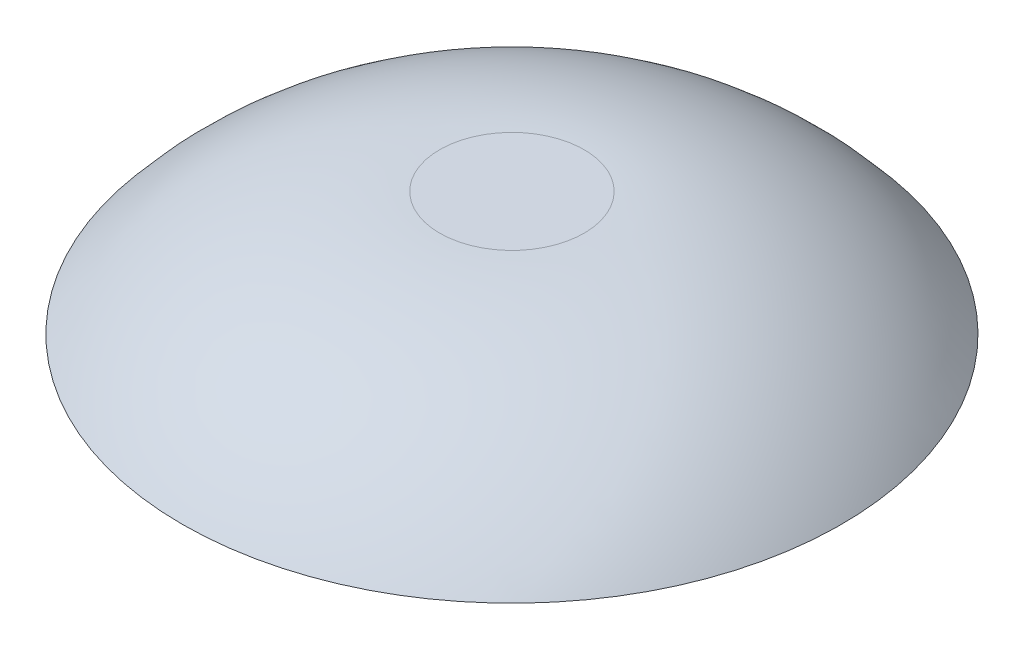
from build123d import *

# Parameters (mm, degrees)
SKETCH1_R           = 20
BOSS_EXTRUDE1_DEPTH = 7.5
FILLET1_R           = 20
SKETCH2_R           = 6.925
CUT_EXTRUDE1_DEPTH  = 7
SKETCH3_R           = 4.558249482
CUT_EXTRUDE2_DEPTH  = 2.5


with BuildPart() as part:
    # Sketch1 → Boss-Extrude1 (new body)
    with BuildSketch(Plane(origin=(0, 0, 0), x_dir=(1, 0, 0), z_dir=(0, 1, 0))):
        with Locations(Location((0, 0, 0), (0, 0, 270))):
            Circle(SKETCH1_R)
    extrude(amount=BOSS_EXTRUDE1_DEPTH)

    # Fillet1
    # the kernel refuses this fillet: 20 mm, written as the material it takes off along each edge
    with BuildSketch(Plane(origin=(0, 7.5, 0), x_dir=(0, 0, 1), z_dir=(-1, 0, 0))) as fillet1_piece_1:
        with BuildLine():
            CenterArc((4.387505004, -20), FILLET1_R, 38.682187453, 51.317812547)
            Line((4.387505004, 0), (4.387505004, 0.4))
            Line((4.387505004, 0.4), (20, 0.4))
            Line((20, 0.4), (20.4, 0))
            ThreePointArc((20.4, 0), (20.4, -3.75), (20.3122499, -7.25))
            Line((20.3122499, -7.25), (20, -7.5))
        make_face()
    revolve(axis=Axis((0, 7.5, 0), (0, 1, 0)), mode=Mode.SUBTRACT)

    # Sketch2 → Cut-Extrude1 (cut)
    with BuildSketch(Plane.XZ):
        with Locations(Location((0, 0, 0), (0, 0, 270))):
            Circle(SKETCH2_R)
        Polygon((3.1, -1.789785834), (3.1, 1.789785834), (0, 3.579571669), (-3.1, 1.789785834), (-3.1, -1.789785834), (0, -3.579571669), align=None, mode=Mode.SUBTRACT)
    extrude(amount=-CUT_EXTRUDE1_DEPTH, mode=Mode.SUBTRACT)

    # Sketch3 → Cut-Extrude2 (cut)
    with BuildSketch(Plane.XZ):
        Circle(SKETCH3_R)
    extrude(amount=-CUT_EXTRUDE2_DEPTH, mode=Mode.SUBTRACT)


solid = part.part
